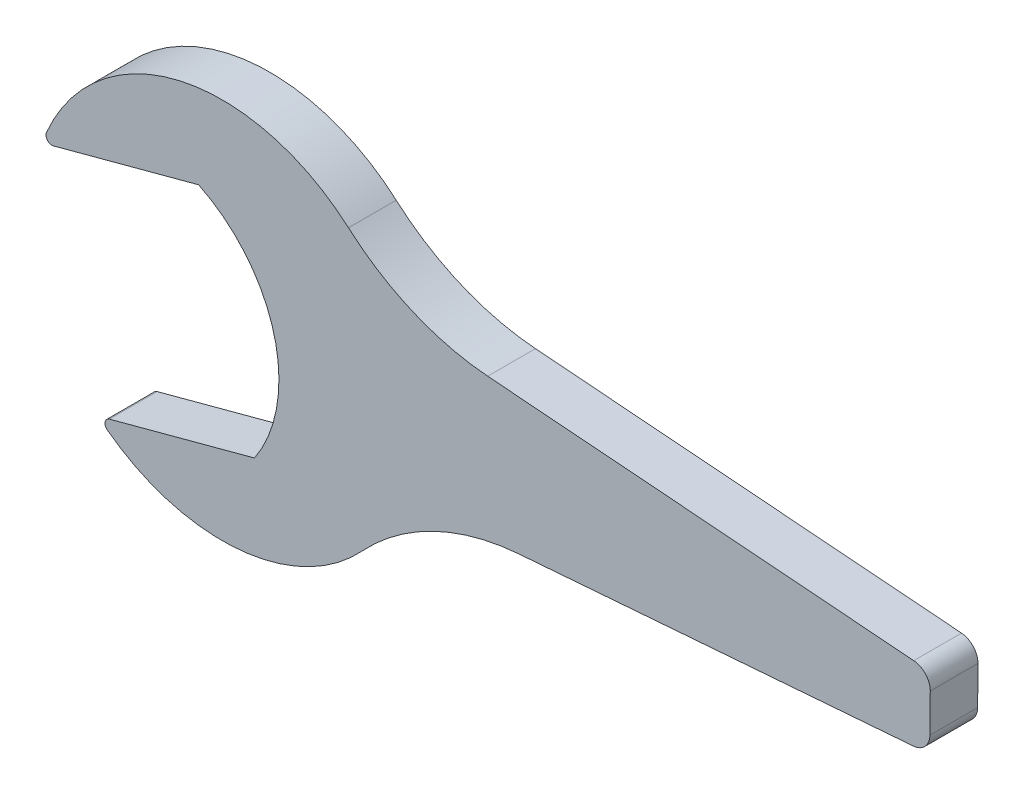
from build123d import *

# Parameters (mm, degrees)
BOSS_EXTRUDE1_DEPTH = 40
FILLET1_R           = 5
FILLET2_R           = 200
FILLET3_R           = 15


with BuildPart() as part:
    # Sketch1 → Boss-Extrude1 (new body)
    with BuildSketch(Plane.XY):
        with BuildLine():
            Line((-194.339846129, 41.6192895), (-63.217367668, 76.753451713))
            ThreePointArc((-63.217367668, 76.753451713), (0, 0), (-16.371120504, -98.079122845))
            Line((-16.371120504, -98.079122845), (-147.493598965, -133.213285059))
            ThreePointArc((-147.493598965, -133.213285059), (-1.88448773, -166.149034256), (107.524129639, -64.578707413))
            Line((107.524129639, -64.578707413), (549.425609202, -30.02245839))
            Line((549.425609202, -30.02245839), (550, 29.97754161))
            Line((550, 29.97754161), (96.749243886, 65.421292587))
            ThreePointArc((96.749243886, 65.421292587), (-56.506149546, 147.820919556), (-194.339846129, 41.6192895))
        make_face()
    extrude(amount=BOSS_EXTRUDE1_DEPTH)

    # Fillet1
    fillet1_edges = [part.edges().sort_by_distance(p)[0] for p in [
        (-147.493598965, -133.213285059, 20),
        (-194.339846129, 41.6192895, 20),
    ]]
    fillet(fillet1_edges, radius=FILLET1_R)

    # Fillet2
    fillet2_edges = [part.edges().sort_by_distance(p)[0] for p in [
        (107.524129639, -64.578707413, 20),
        (96.749243886, 65.421292587, 20),
    ]]
    fillet(fillet2_edges, radius=FILLET2_R)

    # Fillet3
    fillet3_edges = [part.edges().sort_by_distance(p)[0] for p in [
        (550, 29.97754161, 20),
        (549.425609202, -30.02245839, 20),
    ]]
    fillet(fillet3_edges, radius=FILLET3_R)


solid = part.part
